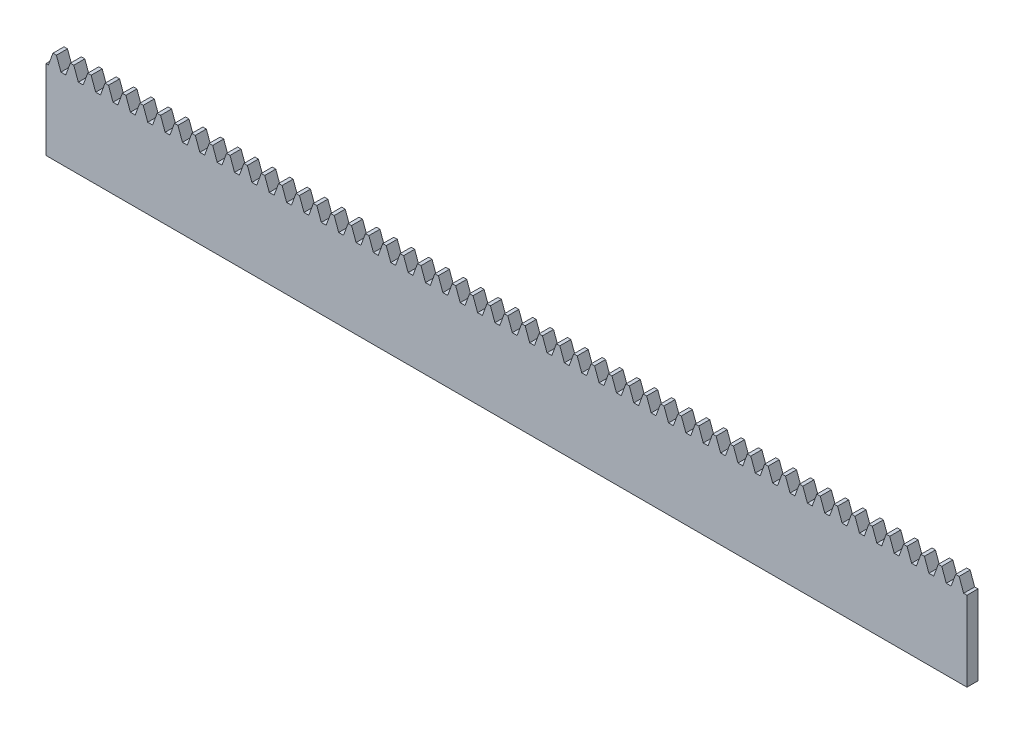
from build123d import *

# Parameters (mm, degrees)
BLANKSKE_W        = 250
BLANKSKE_H        = 25
BLANK_DEPTH       = 3
TOOTHCUTSIM_DEPTH = 252.264800559
TEETHCUTS_COUNT   = 55
TEETHCUTS_PITCH   = 4.712388975


with BuildPart() as part:
    # BlankSke → Blank (new body)
    with BuildSketch(Plane.XY):
        with Locations((125, 12.5)):
            Rectangle(BLANKSKE_W, BLANKSKE_H)
    extrude(amount=-BLANK_DEPTH)

    # TooCutSkeSim → ToothCutSim (cut, through all)
    with BuildSketch(Plane.XY):
        Polygon((0.654653055, 21.625), (-0.654653055, 21.625), (-1.975501035, 25.254), (1.975501035, 25.254), align=None)
    toothcutsim = extrude(amount=-TOOTHCUTSIM_DEPTH, mode=Mode.SUBTRACT)

    # TeethCuts: ToothCutSim ×55
    with Locations(*[(i * TEETHCUTS_PITCH, 0, 0) for i in range(1, TEETHCUTS_COUNT)]):
        add(toothcutsim, mode=Mode.SUBTRACT)


solid = part.part
